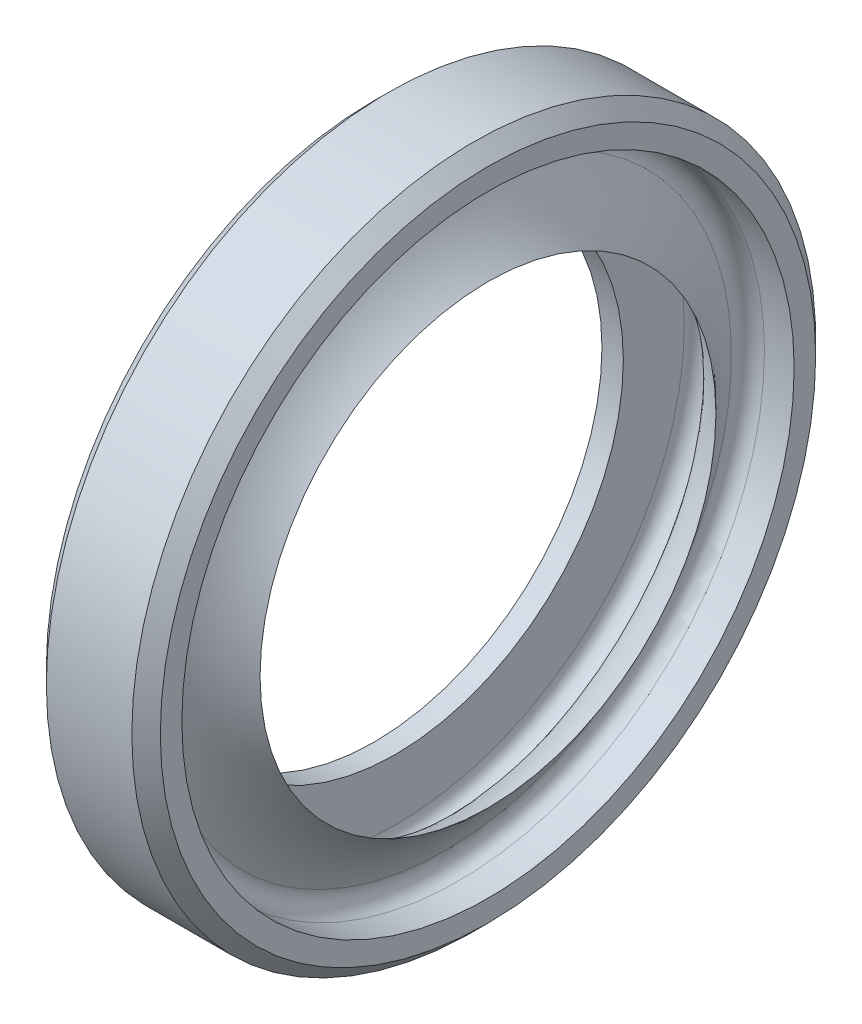
from build123d import *


with BuildPart() as part:
    # Esquisse2 → Révolution1 (revolve)
    with BuildSketch(Plane.XY):
        with BuildLine():
            Line((-5.119383134, 16), (-5.119383134, 23))
            Line((-5.119383134, 23), (-4.119383134, 24))
            Line((-4.119383134, 24), (1.880616866, 24))
            Line((1.880616866, 24), (2.880616866, 23))
            Line((2.880616866, 23), (2.880616866, 21.489974738))
            Line((2.880616866, 21.489974738), (0.796577031, 21.489974738))
            ThreePointArc((0.796577031, 21.489974738), (-0.03904332, 21.039282145), (-0.121447867, 20.093451993))
            ThreePointArc((-0.121447867, 20.093451993), (1.148294876, 17.877102309), (2.880616866, 16))
            ThreePointArc((2.880616866, 16), (0.075925606, 17.946650315), (-1.763498059, 20.822804186))
            ThreePointArc((-1.763498059, 20.822804186), (-2.893972701, 21.243609933), (-3.619383134, 20.279851615))
            Line((-3.619383134, 20.279851615), (-3.619383134, 16))
            Line((-3.619383134, 16), (-5.119383134, 16))
        make_face()
    revolve(axis=Axis((-28.173405565, 0, 0), (1, 0, 0)))


solid = part.part
